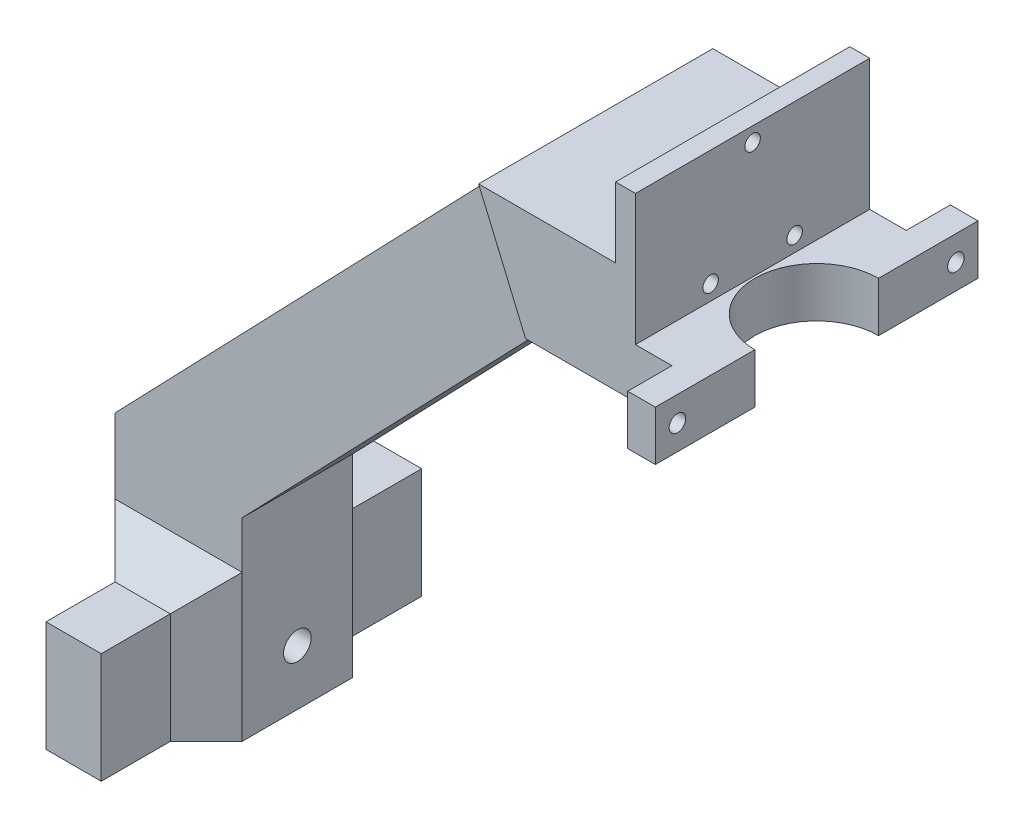
from build123d import *

# Parameters (mm, degrees)
BOSS_EXTRUDE1_DEPTH      = 25.4
BOSS_EXTRUDE4_DEPTH      = 24.13
BOSS_EXTRUDE4_DEPTH_BACK = 49.53
SKETCH7_W                = 12.7
SKETCH7_H                = 25.4
SKETCH8_R                = 3.175
CUT_EXTRUDE3_DEPTH       = 219.535967291
CHAMFER3_SIZE            = 8.255
BOSS_EXTRUDE5_DEPTH      = 14.224
BOSS_EXTRUDE5_DEPTH_BACK = 39.624
SKETCH9_R                = 14.224
CUT_EXTRUDE4_DEPTH       = 188.728167838
SKETCH11_W               = 14.732
SKETCH11_H               = 53.848
CUT_EXTRUDE5_DEPTH       = 13.97
CHAMFER5_SIZE            = 13.97
SKETCH18_W               = 6.35
SKETCH18_H               = 11.43
BOSS_EXTRUDE6_DEPTH      = 10.16
SKETCH19_W               = 6.35
SKETCH19_H               = 11.43
BOSS_EXTRUDE7_DEPTH      = 10.16
SKETCH20_R               = 1.905
CUT_EXTRUDE7_DEPTH       = 10.16
SKETCH21_W               = 4.572
SKETCH21_H               = 53.848
BOSS_EXTRUDE8_DEPTH      = 16.129
SKETCH22_R               = 1.778
CUT_EXTRUDE8_DEPTH       = 4.318
SKETCH23_R               = 2.794
CUT_EXTRUDE9_DEPTH       = 207.118456854


with BuildPart() as part:
    # Sketch2 → Boss-Extrude1 (new body)
    with BuildSketch(Plane.XY):
        Polygon((0, 0), (50.8, 0), (50.8, -25.4), (10.806439585, -25.4), (-68.58, -107.87941775), (-68.58, -152.4), (-97.79, -152.4), (-97.79, -101.6), align=None)
    extrude(amount=BOSS_EXTRUDE1_DEPTH)

    # Sketch7 → Boss-Extrude4 (add, two sides: drawn at the far end of the back side and taken through both)
    with BuildSketch(Plane.XY.offset(25.4).offset(-BOSS_EXTRUDE4_DEPTH_BACK)):
        with Locations((-83.185, -139.7)):
            Rectangle(SKETCH7_W, SKETCH7_H)
    extrude(amount=BOSS_EXTRUDE4_DEPTH + BOSS_EXTRUDE4_DEPTH_BACK)

    # Sketch8 → Cut-Extrude3 (cut, through all)
    with BuildSketch(Plane.ZY.offset(97.79)):
        with Locations((12.7, -139.7)):
            Circle(SKETCH8_R)
    extrude(amount=-CUT_EXTRUDE3_DEPTH, mode=Mode.SUBTRACT)

    # Chamfer3
    chamfer3_edges = [part.edges().sort_by_distance(p)[0] for p in [
        (-76.835, -139.7, 25.4),
        (-76.835, -139.7, 0),
        (-83.185, -127, 25.4),
        (-83.185, -127, 0),
        (-89.535, -139.7, 25.4),
        (-89.535, -139.7, 0),
    ]]
    chamfer(chamfer3_edges, length=CHAMFER3_SIZE - 0.0001)  # a hair under: the kernel refuses the full size

    # Sketch10 → Boss-Extrude5 (add, two sides: drawn at the far end of the back side and taken through both)
    with BuildSketch(Plane.XY.offset(25.4).offset(-BOSS_EXTRUDE5_DEPTH_BACK)):
        Polygon((0, 0), (10.806439585, -25.4), (50.8, -25.4), (50.8, 0), align=None)
    extrude(amount=BOSS_EXTRUDE5_DEPTH + BOSS_EXTRUDE5_DEPTH_BACK)

    # Sketch9 → Cut-Extrude4 (cut, through all)
    with BuildSketch(Plane(origin=(0, 0, 0), x_dir=(1, 0, 0), z_dir=(0, 1, 0))):
        with Locations((50.8, -12.7)):
            Circle(SKETCH9_R)
    extrude(amount=-CUT_EXTRUDE4_DEPTH, mode=Mode.SUBTRACT)

    # Sketch11 → Cut-Extrude5 (cut)
    with BuildSketch(Plane(origin=(0, 0, 0), x_dir=(1, 0, 0), z_dir=(0, 1, 0))):
        with Locations((43.434, -12.7)):
            Rectangle(SKETCH11_W, SKETCH11_H)
    extrude(amount=-CUT_EXTRUDE5_DEPTH, mode=Mode.SUBTRACT)

    # Chamfer5
    chamfer5_edges = [part.edges().sort_by_distance(p)[0] for p in [
        (5.403219792, -12.7, 0),
        (5.403219792, -12.7, 25.4),
    ]]
    chamfer(chamfer5_edges, length=CHAMFER5_SIZE)

    # Sketch18 → Boss-Extrude6 (add)
    with BuildSketch(Plane.XY.offset(39.624)):
        with Locations((47.625, -19.685)):
            Rectangle(SKETCH18_W, SKETCH18_H)
    extrude(amount=BOSS_EXTRUDE6_DEPTH)

    # Sketch19 → Boss-Extrude7 (add)
    with BuildSketch(Plane(origin=(0, 0, -14.224), x_dir=(-1, 0, 0), z_dir=(0, 0, -1))):
        with Locations((-47.625, -19.685)):
            Rectangle(SKETCH19_W, SKETCH19_H)
    extrude(amount=BOSS_EXTRUDE7_DEPTH)

    # Sketch20 → Cut-Extrude7 (cut)
    with BuildSketch(Plane(origin=(50.8, 0, 0), x_dir=(0, 0, -1), z_dir=(1, 0, 0))):
        with Locations((-44.704, -19.685)):
            Circle(SKETCH20_R)
        with Locations((19.304, -19.685)):
            Circle(SKETCH20_R)
    extrude(amount=-CUT_EXTRUDE7_DEPTH, mode=Mode.SUBTRACT)

    # Sketch21 → Boss-Extrude8 (add)
    with BuildSketch(Plane(origin=(0, 0, 0), x_dir=(1, 0, 0), z_dir=(0, 1, 0))):
        with Locations((33.782, -12.7)):
            Rectangle(SKETCH21_W, SKETCH21_H)
    extrude(amount=BOSS_EXTRUDE8_DEPTH)

    # Sketch22 → Cut-Extrude8 (cut)
    with BuildSketch(Plane(origin=(36.068, 0, 0), x_dir=(0, 0, -1), z_dir=(1, 0, 0))):
        with Locations((-12.7, 12.827)):
            Circle(SKETCH22_R)
        with Locations((-22.352, -10.4775)):
            Circle(SKETCH22_R)
        with Locations((-3.048, -10.4775)):
            Circle(SKETCH22_R)
    extrude(amount=-CUT_EXTRUDE8_DEPTH, mode=Mode.SUBTRACT)

    # Sketch23 → Cut-Extrude9 (cut, through all)
    with BuildSketch(Plane(origin=(31.75, 0, 0), x_dir=(0, 0, -1), z_dir=(1, 0, 0))):
        with Locations((-22.352, -10.4775)):
            Circle(SKETCH23_R)
        with Locations((-3.048, -10.4775)):
            Circle(SKETCH23_R)
    extrude(amount=-CUT_EXTRUDE9_DEPTH, mode=Mode.SUBTRACT)


solid = part.part
